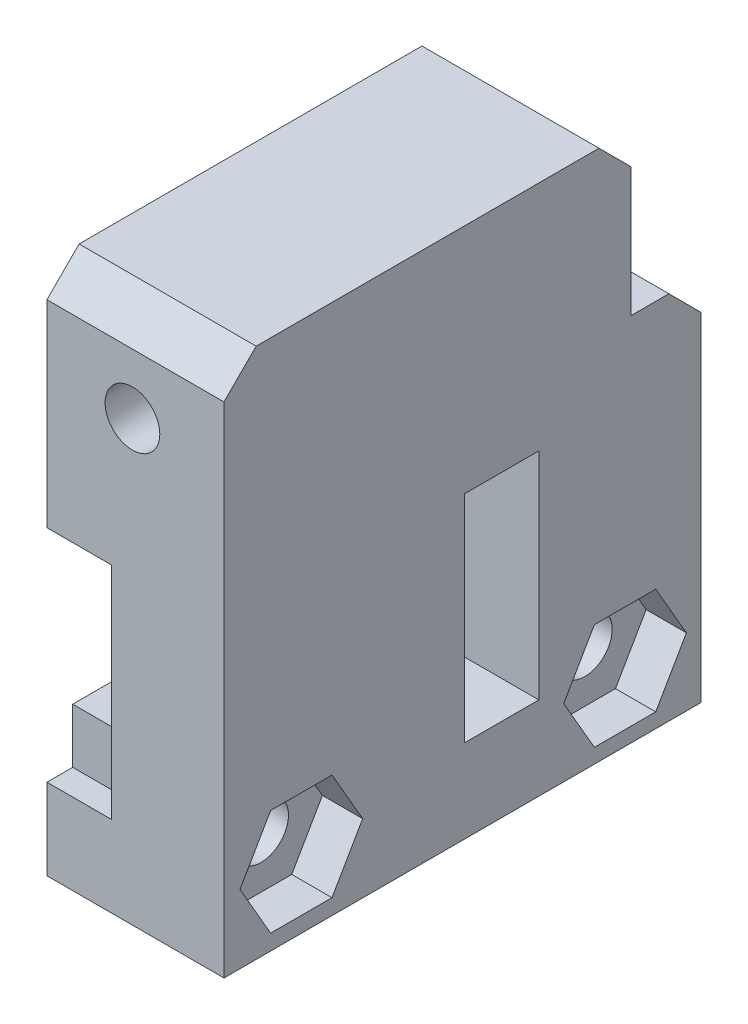
from build123d import *

# Parameters (mm, degrees)
SKETCH1_W           = 29.64084851
SKETCH1_H           = 22.995210284
BOSS_EXTRUDE1_DEPTH = 11
SKETCH2_W           = 11
SKETCH2_H           = 25.30011898
BOSS_EXTRUDE2_DEPTH = 10
CHAMFER1_SIZE       = 2
SKETCH3_W           = 31.444464136
SKETCH3_H           = 13.690550156
CUT_EXTRUDE2_DEPTH  = 4
SKETCH4_W           = 16.801230495
SKETCH4_H           = 6.210132239
BOSS_EXTRUDE3_DEPTH = 7
SKETCH5_R           = 2.040999549
CUT_EXTRUDE3_DEPTH  = 33.013106791
SKETCH6_W           = 4.621469737
SKETCH6_H           = 13.3986797
CUT_EXTRUDE4_DEPTH  = 30.627554775
SKETCH7_R           = 1.7
CUT_EXTRUDE5_DEPTH  = 27
SKETCH21_W          = 6.4100694
SKETCH21_H          = 8.3354859
BOSS_EXTRUDE4_DEPTH = 11
SKETCH20_W          = 6.410069378
SKETCH20_H          = 8.335485858
BOSS_EXTRUDE5_DEPTH = 11
CUT_EXTRUDE6_DEPTH  = 2.5
SKETCH19_R          = 1.7
CUT_EXTRUDE7_DEPTH  = 30.627554775
CUT_EXTRUDE8_DEPTH  = 2.5
SKETCH18_R          = 1.7
CUT_EXTRUDE9_DEPTH  = 30.627554775


with BuildPart() as part:
    # Sketch1 → Boss-Extrude1 (new body)
    with BuildSketch(Plane(origin=(0, 0, 0), x_dir=(0, 0, -1), z_dir=(1, 0, 0))):
        Rectangle(SKETCH1_W, SKETCH1_H)
    extrude(amount=BOSS_EXTRUDE1_DEPTH)

    # Sketch2 → Boss-Extrude2 (add)
    with BuildSketch(Plane(origin=(0, 11.497605142, 0), x_dir=(1, 0, 0), z_dir=(0, 1, 0))):
        with Locations((5.5, -2.170364765)):
            Rectangle(SKETCH2_W, SKETCH2_H)
    extrude(amount=BOSS_EXTRUDE2_DEPTH)

    # Chamfer1
    chamfer1_edges = [part.edges().sort_by_distance(p)[0] for p in [
        (5.5, 11.497605142, -14.820424255),
        (5.5, 21.497605142, -10.479694725),
        (5.5, 21.497605142, 14.820424255),
    ]]
    chamfer(chamfer1_edges, length=CHAMFER1_SIZE)

    # Sketch3 → Cut-Extrude2 (cut)
    with BuildSketch(Plane.ZY):
        with Locations((0.26445091, 0.38357275)):
            Rectangle(SKETCH3_W, SKETCH3_H)
    extrude(amount=-CUT_EXTRUDE2_DEPTH, mode=Mode.SUBTRACT)

    # Sketch4 → Boss-Extrude3 (add)
    with BuildSketch(Plane(origin=(4, 0.435062227, 0), x_dir=(0, 0, 1), z_dir=(-1, 0, 0))):
        with Locations((-2.204570257, -0.002306757)):
            Rectangle(SKETCH4_W, SKETCH4_H)
    extrude(amount=BOSS_EXTRUDE3_DEPTH)

    # Sketch5 → Cut-Extrude3 (cut, through all)
    with BuildSketch(Plane.XY.offset(6.196044991)):
        with Locations((0.634248811, 0.454719166)):
            Circle(SKETCH5_R)
    extrude(amount=-CUT_EXTRUDE3_DEPTH, mode=Mode.SUBTRACT)

    # Sketch6 → Cut-Extrude4 (cut, through all)
    with BuildSketch(Plane(origin=(11, 0, 0), x_dir=(0, 0, -1), z_dir=(1, 0, 0))):
        with Locations((2.429578273, 0.383063563)):
            Rectangle(SKETCH6_W, SKETCH6_H)
    extrude(amount=-CUT_EXTRUDE4_DEPTH, mode=Mode.SUBTRACT)

    # Sketch7 → Cut-Extrude5 (cut)
    with BuildSketch(Plane.XY.offset(14.820424255)):
        with Locations((5.312142967, 15.762432364)):
            Circle(SKETCH7_R)
    extrude(amount=-CUT_EXTRUDE5_DEPTH, mode=Mode.SUBTRACT)

    # Sketch21 → Boss-Extrude4 (add)
    with BuildSketch(Plane(origin=(11, 0, 0), x_dir=(0, 0, -1), z_dir=(1, 0, 0))):
        with Locations((10.097369078, -7.290376311)):
            Rectangle(SKETCH21_W, SKETCH21_H)
    extrude(amount=-BOSS_EXTRUDE4_DEPTH)

    # Sketch20 → Boss-Extrude5 (add)
    with BuildSketch(Plane(origin=(11, 0, 0), x_dir=(0, 0, -1), z_dir=(1, 0, 0))):
        with Locations((-10.015073396, -7.232029734)):
            Rectangle(SKETCH20_W, SKETCH20_H)
    extrude(amount=-BOSS_EXTRUDE5_DEPTH)

    # Sketch15 → Cut-Extrude6 (cut)
    with BuildSketch(Plane(origin=(11, 0, 0), x_dir=(0, 0, -1), z_dir=(1, 0, 0))):
        Polygon((-8.109817508, -10.532029734), (-6.204561619, -7.232029734), (-8.109817508, -3.932029734), (-11.920329284, -3.932029734), (-13.825585173, -7.232029734), (-11.920329284, -10.532029734), align=None)
    extrude(amount=-CUT_EXTRUDE6_DEPTH, mode=Mode.SUBTRACT)

    # Sketch19 → Cut-Extrude7 (cut, through all)
    with BuildSketch(Plane(origin=(11, 0, 0), x_dir=(0, 0, -1), z_dir=(1, 0, 0))):
        with Locations((-10.015073396, -7.232029734)):
            Circle(SKETCH19_R)
    extrude(amount=-CUT_EXTRUDE7_DEPTH, mode=Mode.SUBTRACT)

    # Sketch17 → Cut-Extrude8 (cut)
    with BuildSketch(Plane(origin=(11, 0, 0), x_dir=(0, 0, -1), z_dir=(1, 0, 0))):
        Polygon((12.002624966, -10.590376311), (13.907880854, -7.290376311), (12.002624966, -3.990376311), (8.192113189, -3.990376311), (6.286857301, -7.290376311), (8.192113189, -10.590376311), align=None)
    extrude(amount=-CUT_EXTRUDE8_DEPTH, mode=Mode.SUBTRACT)

    # Sketch18 → Cut-Extrude9 (cut, through all)
    with BuildSketch(Plane(origin=(11, 0, 0), x_dir=(0, 0, -1), z_dir=(1, 0, 0))):
        with Locations((10.097369078, -7.290376311)):
            Circle(SKETCH18_R)
    extrude(amount=-CUT_EXTRUDE9_DEPTH, mode=Mode.SUBTRACT)


solid = part.part
